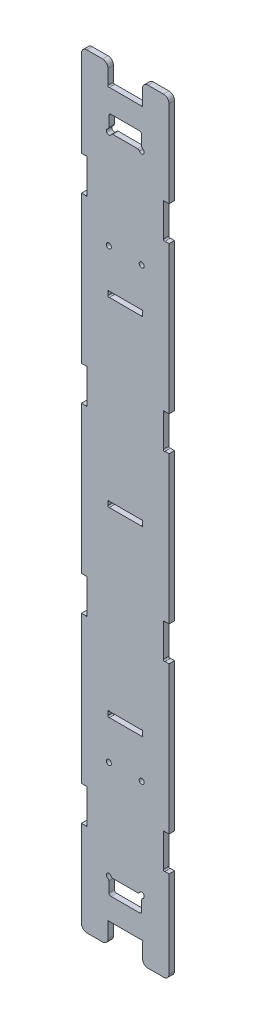
from build123d import *

# Parameters (mm, degrees)
SKETCH1_W               = 50.8
SKETCH1_H               = 3.175
BOSS_EXTRUDE1_DEPTH     = 425.069
RIBSLOTS_DEPTH          = 426.839048686
CUSHIONINDEXTAB_START   = -1.27
SKETCH12_W              = 15.4
SKETCH12_H              = 3.175
CUSHIONINDEXTAB_DEPTH   = 10.414
FILLET1_R               = 3.175
SKETCH13_W              = 3.175
SKETCH13_H              = 20
CUT_EXTRUDE4_DEPTH      = 435.9668608
SKETCH14_R              = 0.5
CUT_EXTRUDE5_DEPTH      = 435.9668608
SKETCH_PATTERN1_START   = -71.842048969
SKETCH_PATTERN1_DEPTH   = 3.175
MIRROR4_COPY_1_SKETCH_R = 0.5
MIRROR4_COPY_1_DEPTH    = 435.9668608
MIRROR4_START           = -71.842048969
MIRROR4_COPY_2_DEPTH    = 3.175
F_4_CLEARANCE_HOLE1_D   = 2.9464
SKETCH19_W              = 19.05
SKETCH19_H              = 9.525
CUT_EXTRUDE6_DEPTH      = 435.9668608
FILLET2_R               = 1.27
FILLET2_OF_MIRROR7_R    = 1.27


# Read off the part's stored shape, not the designer's step: Sketch-Pattern1
with BuildPart() as part:
    # Sketch1 → Boss-Extrude1 (new body)
    with BuildSketch(Plane(origin=(0, 0, 0), x_dir=(1, 0, 0), z_dir=(0, 1, 0))):
        with Locations((0, 70.254548969)):
            Rectangle(SKETCH1_W, SKETCH1_H)
    extrude(amount=BOSS_EXTRUDE1_DEPTH)

    # Sketch11 → ribSlots (cut, through all)
    with BuildSketch(Plane.XY.offset(-68.667048969)):
        with BuildLine():
            Line((9.292893219, 105.4735), (-9.292893219, 105.4735))
            ThreePointArc((-9.292893219, 105.4735), (-10, 105.4735), (-10, 106.180606781))
            Line((-10, 106.180606781), (-10, 107.941393219))
            ThreePointArc((-10, 107.941393219), (-10, 108.6485), (-9.292893219, 108.6485))
            Line((-9.292893219, 108.6485), (9.292893219, 108.6485))
            ThreePointArc((9.292893219, 108.6485), (10, 108.6485), (10, 107.941393219))
            Line((10, 107.941393219), (10, 106.180606781))
            ThreePointArc((10, 106.180606781), (10, 105.4735), (9.292893219, 105.4735))
        make_face()
        with BuildLine():
            Line((9.292893219, 0), (-9.292893219, 0))
            ThreePointArc((-9.292893219, 0), (-10, 0), (-10, 0.707106781))
            Line((-10, 0.707106781), (-10, 2.467893219))
            ThreePointArc((-10, 2.467893219), (-10, 3.175), (-9.292893219, 3.175))
            Line((-9.292893219, 3.175), (9.292893219, 3.175))
            ThreePointArc((9.292893219, 3.175), (10, 3.175), (10, 2.467893219))
            Line((10, 2.467893219), (10, 0.707106781))
            ThreePointArc((10, 0.707106781), (10, 0), (9.292893219, 0))
        make_face()
        with BuildLine():
            Line((9.292893219, 210.947), (-9.292893219, 210.947))
            ThreePointArc((-9.292893219, 210.947), (-10, 210.947), (-10, 211.654106781))
            Line((-10, 211.654106781), (-10, 213.414893219))
            ThreePointArc((-10, 213.414893219), (-10, 214.122), (-9.292893219, 214.122))
            Line((-9.292893219, 214.122), (9.292893219, 214.122))
            ThreePointArc((9.292893219, 214.122), (10, 214.122), (10, 213.414893219))
            Line((10, 213.414893219), (10, 211.654106781))
            ThreePointArc((10, 211.654106781), (10, 210.947), (9.292893219, 210.947))
        make_face()
    ribslots = extrude(amount=-RIBSLOTS_DEPTH, mode=Mode.SUBTRACT)

    # Sketch12 → cushionIndexTab (add)
    with BuildSketch(Plane.XZ.offset(CUSHIONINDEXTAB_START)):
        with Locations((-17.7, -70.254548969)):
            Rectangle(SKETCH12_W, SKETCH12_H)
        with Locations((17.7, -70.254548969)):
            Rectangle(SKETCH12_W, SKETCH12_H)
    cushionindextab = extrude(amount=CUSHIONINDEXTAB_DEPTH)

    # Mirror2: ribSlots, cushionIndexTab across plane
    add(ribslots.mirror(Plane.ZX.offset(212.5345)), mode=Mode.SUBTRACT)
    add(cushionindextab.mirror(Plane.ZX.offset(212.5345)))

    # Fillet1
    fillet1_edges = [part.edges().sort_by_distance(p)[0] for p in [
        (-25.4, -9.144, -70.254548969),
        (-10, -9.144, -70.254548969),
        (25.4, -9.144, -70.254548969),
        (10, -9.144, -70.254548969),
        (-10, 434.213, -70.254548969),
        (-25.4, 434.213, -70.254548969),
        (10, 434.213, -70.254548969),
        (25.4, 434.213, -70.254548969),
    ]]
    fillet(fillet1_edges, radius=FILLET1_R)

    # Sketch13 → Cut-Extrude4 (cut, symmetric)
    with BuildSketch(Plane.XY.offset(-68.667048969)):
        with Locations((-23.8125, 370.74475)):
            Rectangle(SKETCH13_W, SKETCH13_H)
        with Locations((-23.8125, 265.27125)):
            Rectangle(SKETCH13_W, SKETCH13_H)
        with Locations((-23.8125, 159.79775)):
            Rectangle(SKETCH13_W, SKETCH13_H)
        with Locations((-23.8125, 54.32425)):
            Rectangle(SKETCH13_W, SKETCH13_H)
    cut_extrude4 = extrude(amount=CUT_EXTRUDE4_DEPTH, both=True, mode=Mode.SUBTRACT)

    # Sketch14 → Cut-Extrude5 (cut, symmetric)
    with BuildSketch(Plane.XY.offset(-68.667048969)):
        with Locations((-22.578553391, 380.391196609)):
            Circle(SKETCH14_R)
    cut_extrude5 = extrude(amount=CUT_EXTRUDE5_DEPTH, both=True, mode=Mode.SUBTRACT)

    # Sketch-Pattern1 outline → Sketch-Pattern1 (cut)
    with BuildSketch(Plane.XY.offset(SKETCH_PATTERN1_START)):
        with BuildLine():
            Line((-22.225, 275.27125), (-22.225, 274.564143219))
            ThreePointArc((-22.225, 274.564143219), (-22.078553391, 274.91769661), (-22.225, 275.27125))
        make_face()
        with BuildLine():
            Line((-22.932106781, 275.27125), (-22.225, 275.27125))
            ThreePointArc((-22.225, 275.27125), (-22.578553391, 275.417696609), (-22.932106781, 275.27125))
        make_face()
        with BuildLine():
            Line((-22.225, 169.79775), (-22.225, 169.090643219))
            ThreePointArc((-22.225, 169.090643219), (-22.078553391, 169.44419661), (-22.225, 169.79775))
        make_face()
        with BuildLine():
            Line((-22.932106781, 169.79775), (-22.225, 169.79775))
            ThreePointArc((-22.225, 169.79775), (-22.578553391, 169.944196609), (-22.932106781, 169.79775))
        make_face()
        with BuildLine():
            Line((-22.225, 64.32425), (-22.225, 63.617143219))
            ThreePointArc((-22.225, 63.617143219), (-22.078553391, 63.97069661), (-22.225, 64.32425))
        make_face()
        with BuildLine():
            Line((-22.932106781, 64.32425), (-22.225, 64.32425))
            ThreePointArc((-22.225, 64.32425), (-22.578553391, 64.470696609), (-22.932106781, 64.32425))
        make_face()
    sketch_pattern1 = extrude(amount=SKETCH_PATTERN1_DEPTH, mode=Mode.SUBTRACT)

    # Mirror3: Cut-Extrude5, Sketch-Pattern1 across plane
    add(cut_extrude5.mirror(Plane.ZX.offset(212.5345)), mode=Mode.SUBTRACT)
    add(sketch_pattern1.mirror(Plane.ZX.offset(212.5345)), mode=Mode.SUBTRACT)

    # Mirror4: Cut-Extrude4, Cut-Extrude5, Sketch-Pattern1 across plane
    add(cut_extrude4.mirror(Plane(origin=(0, 0, 0), x_dir=(0, 0, 1), z_dir=(1, 0, 0))), mode=Mode.SUBTRACT)
    add(cut_extrude5.mirror(Plane(origin=(0, 0, 0), x_dir=(0, 0, 1), z_dir=(1, 0, 0))), mode=Mode.SUBTRACT)
    add(sketch_pattern1.mirror(Plane(origin=(0, 0, 0), x_dir=(0, 0, 1), z_dir=(1, 0, 0))), mode=Mode.SUBTRACT)

    # Mirror4 copy 1 sketch → Mirror4 copy 1 (cut, symmetric)
    with BuildSketch(Plane(origin=(0, 425.069, -68.667048969), x_dir=(-1, 0, 0), z_dir=(0, 0, 1))):
        with Locations((-22.578553391, 380.391196609)):
            Circle(MIRROR4_COPY_1_SKETCH_R)
    extrude(amount=MIRROR4_COPY_1_DEPTH, both=True, mode=Mode.SUBTRACT)

    # Mirror4 copy 2 sketch → Mirror4 copy 2 (cut)
    with BuildSketch(Plane(origin=(0, 425.069, 0), x_dir=(-1, 0, 0), z_dir=(0, 0, 1)).offset(MIRROR4_START)):
        with BuildLine():
            Line((-22.225, 275.27125), (-22.225, 274.564143219))
            ThreePointArc((-22.225, 274.564143219), (-22.078553391, 274.91769661), (-22.225, 275.27125))
        make_face()
        with BuildLine():
            Line((-22.932106781, 275.27125), (-22.225, 275.27125))
            ThreePointArc((-22.225, 275.27125), (-22.578553391, 275.417696609), (-22.932106781, 275.27125))
        make_face()
        with BuildLine():
            Line((-22.225, 169.79775), (-22.225, 169.090643219))
            ThreePointArc((-22.225, 169.090643219), (-22.078553391, 169.44419661), (-22.225, 169.79775))
        make_face()
        with BuildLine():
            Line((-22.932106781, 169.79775), (-22.225, 169.79775))
            ThreePointArc((-22.225, 169.79775), (-22.578553391, 169.944196609), (-22.932106781, 169.79775))
        make_face()
        with BuildLine():
            Line((-22.225, 64.32425), (-22.225, 63.617143219))
            ThreePointArc((-22.225, 63.617143219), (-22.078553391, 63.97069661), (-22.225, 64.32425))
        make_face()
        with BuildLine():
            Line((-22.932106781, 64.32425), (-22.225, 64.32425))
            ThreePointArc((-22.225, 64.32425), (-22.578553391, 64.470696609), (-22.932106781, 64.32425))
        make_face()
    extrude(amount=MIRROR4_COPY_2_DEPTH, mode=Mode.SUBTRACT)

    # #4 Clearance Hole1 (through all)
    with Locations(Plane.XY.offset(-68.667048969)):
        with Locations((9.525, 399.31975), (-9.525, 399.31975), (9.525, 342.16975), (-9.525, 342.16975)):
            f_4_clearance_hole1 = Hole(F_4_CLEARANCE_HOLE1_D / 2)

    # Sketch19 → Cut-Extrude6 (cut, symmetric)
    with BuildSketch(Plane.XY.offset(-68.667048969)):
        with Locations((0, 404.08225)):
            Rectangle(SKETCH19_W, SKETCH19_H)
    cut_extrude6 = extrude(amount=CUT_EXTRUDE6_DEPTH, both=True, mode=Mode.SUBTRACT)

    # Fillet2
    fillet2_edges = [part.edges().sort_by_distance(p)[0] for p in [
        (8.0518, 399.31975, -70.254548969),
        (9.525, 400.79295, -70.254548969),
        (-9.525, 400.79295, -70.254548969),
        (-9.525, 408.84475, -70.254548969),
        (9.525, 408.84475, -70.254548969),
        (-8.0518, 399.31975, -70.254548969),
    ]]
    fillet(fillet2_edges, radius=FILLET2_R)

    # Mirror7: #4 Clearance Hole1, Cut-Extrude6 across plane
    add(f_4_clearance_hole1.mirror(Plane.ZX.offset(212.5345)), mode=Mode.SUBTRACT)
    add(cut_extrude6.mirror(Plane.ZX.offset(212.5345)), mode=Mode.SUBTRACT)

    # Fillet2 of Mirror7
    fillet2_of_mirror7_edges = [part.edges().sort_by_distance(p)[0] for p in [
        (8.0518, 25.74925, -70.254548969),
        (9.525, 24.27605, -70.254548969),
        (-9.525, 24.27605, -70.254548969),
        (-9.525, 16.22425, -70.254548969),
        (9.525, 16.22425, -70.254548969),
        (-8.0518, 25.74925, -70.254548969),
    ]]
    fillet(fillet2_of_mirror7_edges, radius=FILLET2_OF_MIRROR7_R)


solid = part.part
